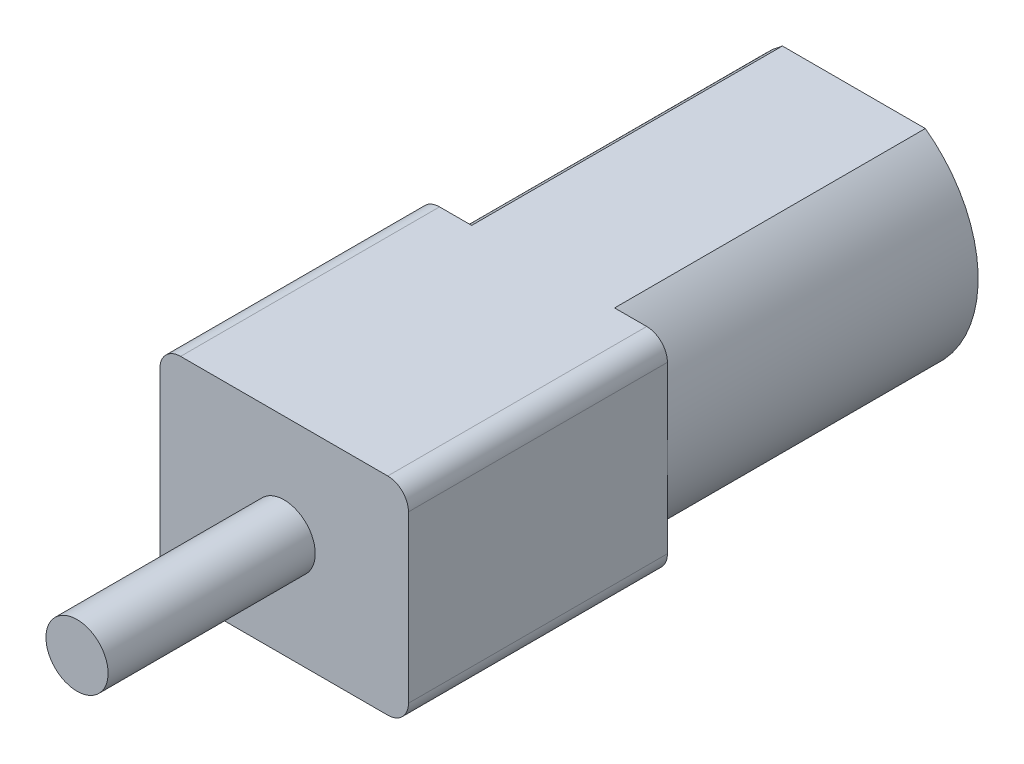
from build123d import *

# Parameters (mm, degrees)
BOSS_EXTRUDE1_DEPTH = 15
SKETCH2_W           = 12
SKETCH2_H           = 10
BOSS_EXTRUDE2_DEPTH = 12.5
FILLET1_R           = 1
SKETCH3_R           = 1.5
BOSS_EXTRUDE3_DEPTH = 10
SKETCH4_R           = 2.5
BOSS_EXTRUDE4_DEPTH = 1.2


with BuildPart() as part:
    # Sketch1 → Boss-Extrude1 (new body)
    with BuildSketch(Plane.XY):
        with BuildLine():
            Line((-3.45, 5), (3.45, 5))
            ThreePointArc((3.45, 5), (6, 0), (3.45, -5))
            Line((3.45, -5), (-3.45, -5))
            ThreePointArc((-3.45, -5), (-6, 0), (-3.45, 5))
        make_face()
    extrude(amount=BOSS_EXTRUDE1_DEPTH)

    # Sketch2 → Boss-Extrude2 (add)
    with BuildSketch(Plane.XY.offset(15)):
        Rectangle(SKETCH2_W, SKETCH2_H)
    extrude(amount=BOSS_EXTRUDE2_DEPTH)

    # Fillet1
    fillet1_edges = [part.edges().sort_by_distance(p)[0] for p in [
        (6, 5, 21.25),
        (6, -5, 21.25),
        (-6, -5, 21.25),
        (-6, 5, 21.25),
    ]]
    fillet(fillet1_edges, radius=FILLET1_R)

    # Sketch3 → Boss-Extrude3 (add)
    with BuildSketch(Plane.XY.offset(27.5)):
        Circle(SKETCH3_R)
    extrude(amount=BOSS_EXTRUDE3_DEPTH)

    # Sketch4 → Boss-Extrude4 (add)
    with BuildSketch(Plane(origin=(0, 0, 0), x_dir=(-1, 0, 0), z_dir=(0, 0, -1))):
        Circle(SKETCH4_R)
    extrude(amount=BOSS_EXTRUDE4_DEPTH)


solid = part.part
